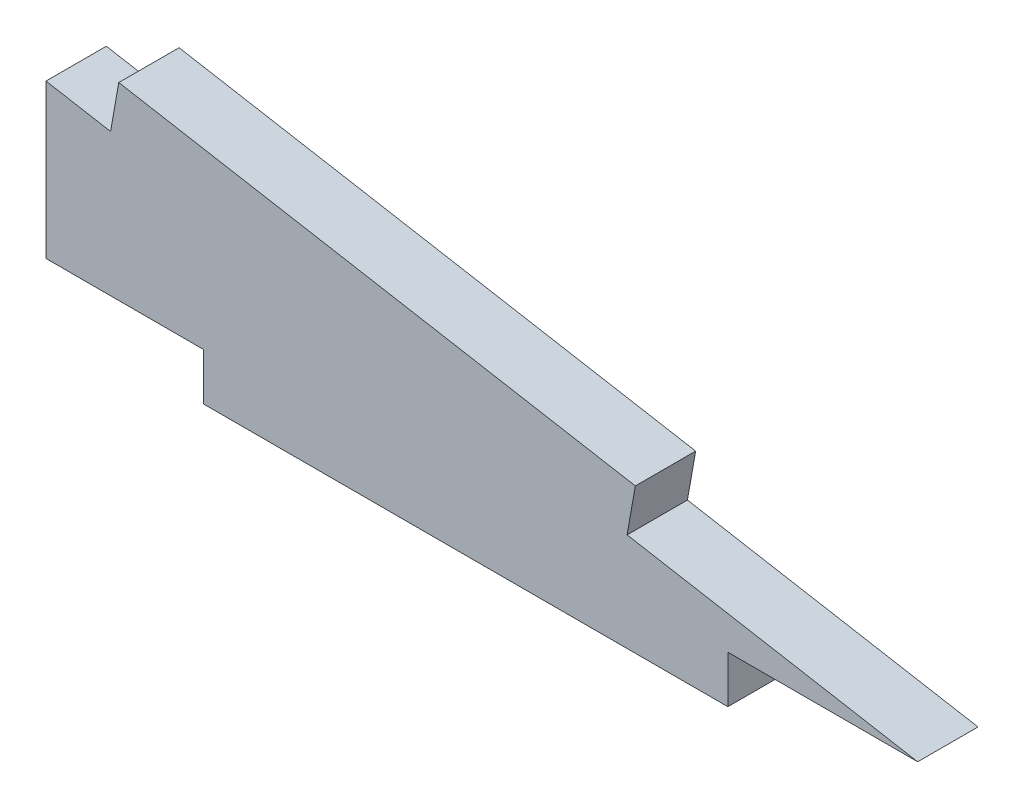
from build123d import *

# Parameters (mm, degrees)
EXTRUDE_1_DEPTH = 4.6


with BuildPart() as part:
    # 草图1 → 凸台-拉伸1 (new body)
    with BuildSketch(Plane.XY):
        Polygon((-22.382284479, 3.715751967), (-22.382284479, 7.315751967), (-34.382284479, 7.315751967), (-34.382284479, 19.03700396), (-29.458245714, 18.168763071), (-28.833112274, 21.714070982), (10.559197847, 14.768143876), (9.934064407, 11.222835965), (21.013151628, 9.269293966), (32.09223885, 7.315751967), (24.854977186, 7.315751967), (17.617715521, 7.315751967), (17.617715521, 3.715751967), align=None)
    extrude(amount=EXTRUDE_1_DEPTH)


solid = part.part
